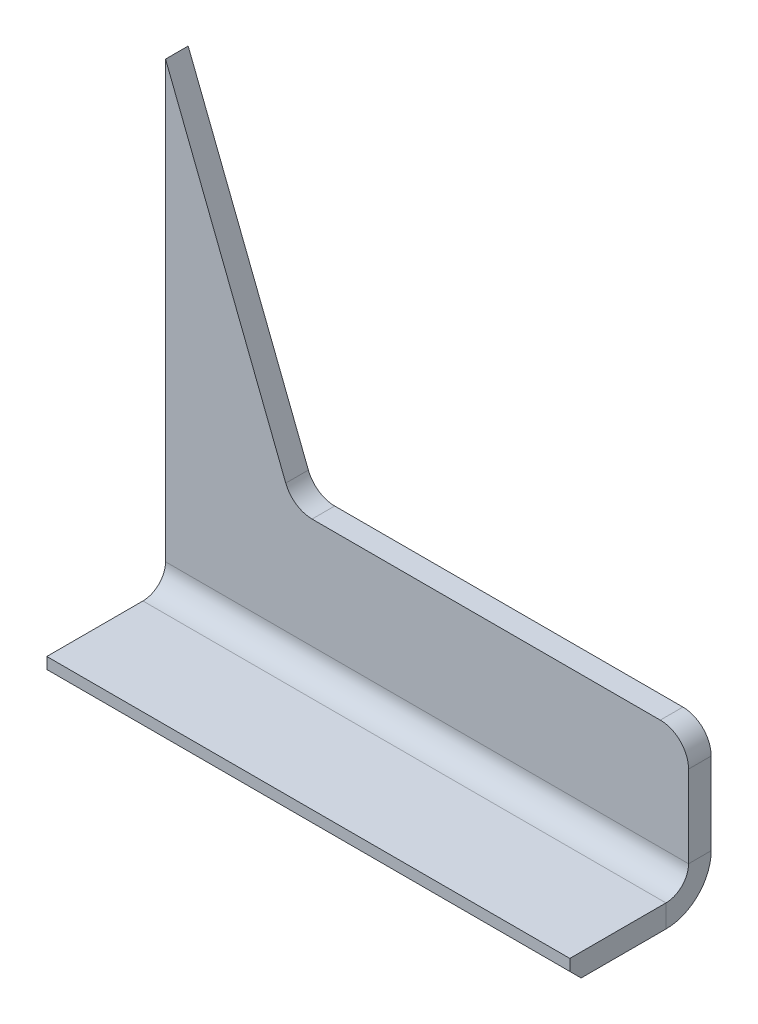
from build123d import *

# Parameters (mm, degrees)
SM_BASE_FLANGE_1_DEPTH           = 8
SM_EDGE_FLANGE_1_STRIP_W         = 48
SM_EDGE_FLANGE_1_STRIP_H         = 8
SM_EDGE_FLANGE_1_STRIP_CUT_DEPTH = 185
SM_EDGE_FLANGE_1_DEPTH           = 185
FILLET_1_R                       = 10
CHAMFER_1_SIZE                   = 4


# Sheet-metal steps are written as plain solids
with BuildPart() as part:
    # Sketch 1 → 基体-法兰1 (new body)
    with BuildSketch(Plane.XY):
        Polygon((0, 0), (45, -115), (185, -115), (185, -170), (0, -170), align=None)
    extrude(amount=-SM_BASE_FLANGE_1_DEPTH)

    # 边线-法兰1 strip (across the edge) → 边线-法兰1 strip cut (cut)
    with BuildSketch(Plane(origin=(0, -170, 0), x_dir=(0, 1, 0), z_dir=(1, 0, 0))):
        with Locations((-8, -4)):
            Rectangle(SM_EDGE_FLANGE_1_STRIP_W, SM_EDGE_FLANGE_1_STRIP_H)
    extrude(amount=SM_EDGE_FLANGE_1_STRIP_CUT_DEPTH, mode=Mode.SUBTRACT)

    # 边线-法兰1 section (across the edge) → 边线-法兰1 (add)
    with BuildSketch(Plane(origin=(0, -170, 0), x_dir=(0, 1, 0), z_dir=(1, 0, 0))):
        with BuildLine():
            Line((0, 8), (0, 42))
            Line((0, 42), (8, 42))
            Line((8, 42), (8, 8))
            ThreePointArc((8, 8), (10.343145751, 2.343145751), (16, 0))
            Line((16, 0), (16, -8))
            ThreePointArc((16, -8), (4.686291501, -3.313708499), (0, 8))
        make_face()
    extrude(amount=SM_EDGE_FLANGE_1_DEPTH)

    # 圆角1
    fillet_1_edges = [part.edges().sort_by_distance(p)[0] for p in [
        (45, -115, -4),
        (185, -115, -4),
    ]]
    fillet(fillet_1_edges, radius=FILLET_1_R)

    # 倒角1
    chamfer_1_edges = [part.edges().sort_by_distance(p)[0] for p in [
        (92.5, -170, 42),
    ]]
    chamfer(chamfer_1_edges, length=CHAMFER_1_SIZE)


solid = part.part
